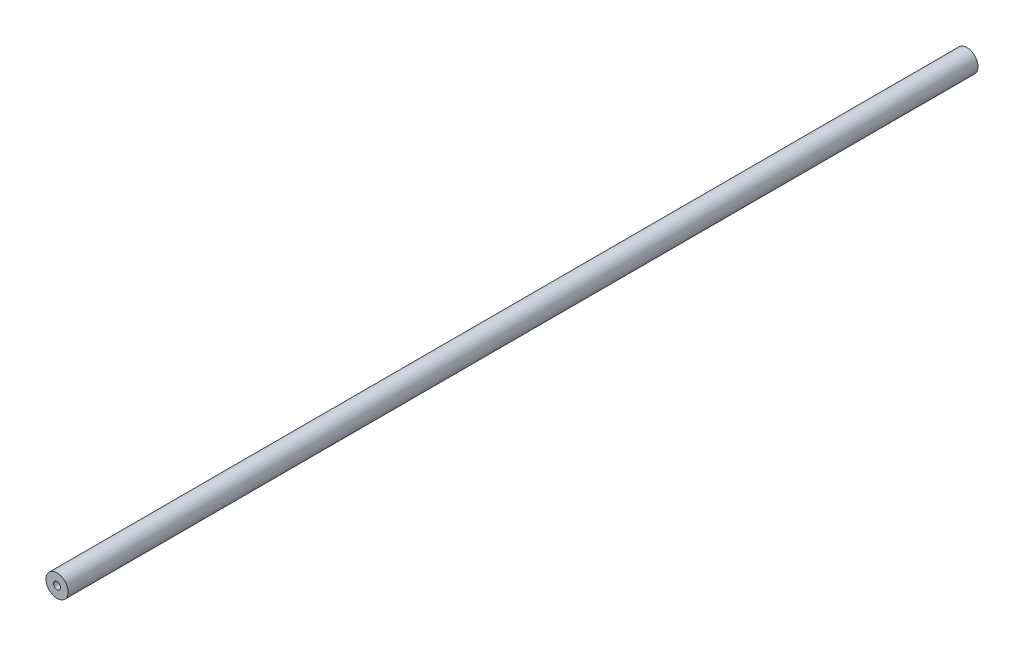
from build123d import *

# Parameters (mm, degrees)
SKETCH1_R                  = 6.35
BOSS_EXTRUDE1_DEPTH        = 521.208
F_10_32_TAPPED_HOLE1_D     = 4.0386
F_10_32_TAPPED_HOLE1_DEPTH = 13.716
F_10_32_TAPPED_HOLE1_TIP   = 1.213317848
F_10_32_TAPPED_HOLE2_D     = 4.0386
F_10_32_TAPPED_HOLE2_DEPTH = 13.716
F_10_32_TAPPED_HOLE2_TIP   = 1.213317848


with BuildPart() as part:
    # Sketch1 → Boss-Extrude1 (new body)
    with BuildSketch(Plane.XY):
        Circle(SKETCH1_R)
    extrude(amount=BOSS_EXTRUDE1_DEPTH)

    # #10-32 Tapped Hole1
    with Locations(Plane.XY.offset(521.208)):
        with Locations((0, 0)):
            Hole(F_10_32_TAPPED_HOLE1_D / 2, depth=F_10_32_TAPPED_HOLE1_DEPTH)
            with Locations((0, 0, -(F_10_32_TAPPED_HOLE1_DEPTH + F_10_32_TAPPED_HOLE1_TIP / 2))):  # 118° drill point
                Cone(0, F_10_32_TAPPED_HOLE1_D / 2, F_10_32_TAPPED_HOLE1_TIP, mode=Mode.SUBTRACT)

    # #10-32 Tapped Hole2
    with Locations(Plane(origin=(0, 0, 0), x_dir=(-1, 0, 0), z_dir=(0, 0, -1))):
        with Locations((0, 0)):
            Hole(F_10_32_TAPPED_HOLE2_D / 2, depth=F_10_32_TAPPED_HOLE2_DEPTH)
            with Locations((0, 0, -(F_10_32_TAPPED_HOLE2_DEPTH + F_10_32_TAPPED_HOLE2_TIP / 2))):  # 118° drill point
                Cone(0, F_10_32_TAPPED_HOLE2_D / 2, F_10_32_TAPPED_HOLE2_TIP, mode=Mode.SUBTRACT)


solid = part.part
